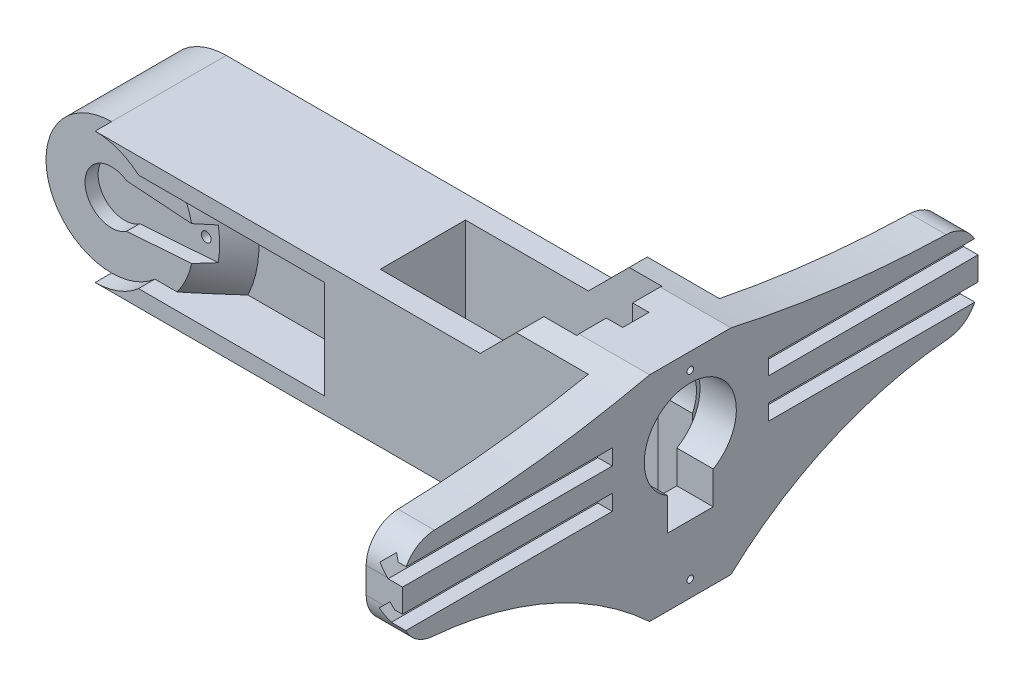
from build123d import *

# Parameters (mm, degrees)
SKETCH1_R                = 2
BOSS_EXTRUDE3_DEPTH      = 7
SKETCH3_R                = 1.0000000000000002
SKETCH3_R_2              = 0.9999999999999998
SKETCH3_R_3              = 0.9999999999999996
SKETCH3_R_4              = 0.9999999999999993
CUT_EXTRUDE2_DEPTH       = 26.09227496303999
BOSS_EXTRUDE4_START      = -7
BOSS_EXTRUDE4_DEPTH      = 7
BOSS_EXTRUDE5_START      = -30
BOSS_EXTRUDE5_DEPTH      = 30
FILLET2_R                = 1.5
CUT_EXTRUDE5_DEPTH       = 42.36510924463761
BOSS_EXTRUDE6_DEPTH      = 10.5
MOVE_START               = -28.7
MOVE_FACE1_DEPTH         = 5.7
DELETEFACE1_START        = 23.7
DELETEFACE1_OUTLINE_W    = 10.499999999999998
DELETEFACE1_OUTLINE_H    = 35.699999999999996
DELETEFACE1_DEPTH        = 15.7
SKETCH11_OUTSIDE_W       = 51.876
SKETCH11_OUTSIDE_H       = 42.462
CUT_EXTRUDE6_DEPTH       = 46.16926949380307
SERVO_START              = -12.760864102
SERVO_MICRO_OUTLINE_W    = 22.6
SERVO_MICRO_OUTLINE_H    = 12.399999999999999
SERVO_MICRO_DEPTH        = 22.3
SERVO_START_2            = 9.539135898
SERVO_MICRO_2_DEPTH      = 4.3
SERVO_START_3            = 2.889135898
SERVO_MICRO_3_DEPTH      = 2.4
SERVO_START_4            = 13.839135898
SERVO_MICRO_4_OUTLINE_R  = 2.5
SERVO_MICRO_4_DEPTH      = 3.3
SERVO_START_5            = -25.667487826
SERVO_MICRO_5_OUTLINE_R  = 0.6
SERVO_MICRO_5_DEPTH      = 2.3
SERVO_MICRO_6_OUTLINE_R  = 0.6
SERVO_MICRO_6_DEPTH      = 2.3
SERVO_MICRO_7_OUTLINE_R  = 0.6
SERVO_MICRO_7_DEPTH      = 2.3
BODY_MOVE_COPY1_ANGLE    = 90
SKETCH13_R               = 0.5000000000000009
SKETCH13_W               = 12.399999999999997
SKETCH13_H               = 4.17
SKETCH13_H_2             = 4.160545319150279
BOSS_EXTRUDE7_DEPTH      = 5.55
SKETCH13_3_W             = 12.399999999999997
SKETCH13_3_H             = 4.17
SKETCH13_3_R             = 0.5000000000000009
SKETCH13_3_H_2           = 4.160545319150279
BOSS_EXTRUDE8_DEPTH      = 10.8
CUT_EXTRUDE7_DEPTH       = 32
BOSS_EXTRUDE9_DEPTH      = 5.55
CUT_EXTRUDE8_DEPTH       = 72.0125468998838
BOSS_EXTRUDE10_DEPTH     = 5.55
FILLET4_R                = 5
CUT_EXTRUDE10_DEPTH      = 72.01254695034633
FILLET9_R                = 1
CUT_EXTRUDE12_DEPTH      = 69.37995941638475
CUT_EXTRUDE12_DEPTH_BACK = 69.37995941638475
BOSS_EXTRUDE11_DEPTH     = 70
BOSS_EXTRUDE12_REACH     = 82.196
SKETCH24_R               = 9.99999999999995
CHAMFER1_SIZE            = 7.5
SKETCH25_R               = 3.7999999999999967
CUT_EXTRUDE13_DEPTH      = 5
CUT_EXTRUDE14_DEPTH      = 30
BOSS_EXTRUDE13_DEPTH     = 9.999999999999996
BOSS_EXTRUDE14_DEPTH     = 25.25
SKETCH30_W               = 20
SKETCH30_H               = 14.999999999999993
BOSS_EXTRUDE15_DEPTH     = 5
CHAMFER2_START           = -5.424363199
CHAMFER2_DEPTH           = 4.330127019
CHAMFER3_START           = -5.429821862
CHAMFER3_DEPTH           = 4.330127019
CHAMFER4_START           = -22.981270045
CHAMFER4_DEPTH           = 4.330127019
CHAMFER5_START           = -22.975811382
CHAMFER5_DEPTH           = 4.330127018
CHAMFER6_SIZE            = 6.5
SKETCH31_R               = 0.5999999999998328
SKETCH31_R_2             = 0.8000000000000026
CUT_EXTRUDE15_DEPTH      = 4.5
CUT_EXTRUDE16_DEPTH      = 2.5
CUT_EXTRUDE17_DEPTH      = 12
CUT_EXTRUDE17_DEPTH_BACK = 4
SKETCH34_R               = 0.7499999999999986
CUT_EXTRUDE18_REACH      = 102.79
SKETCH36_R               = 6.5
CUT_EXTRUDE19_DEPTH      = 20
SKETCH37_W               = 3.444399263997859
SKETCH37_H               = 3.2882016681767823
CUT_EXTRUDE20_DEPTH      = 10
SKETCH39_W               = 2.5
SKETCH39_H               = 3.9999999999999964
CUT_EXTRUDE22_DEPTH      = 12


with BuildPart() as part:
    # Sketch1 → Boss-Extrude3 (new body)
    with BuildSketch(Plane.XY):
        with BuildLine():
            Line((5.606455718863049, 13.824363162033857), (-15.462379801128069, 15.791841653866829))
            Line((-15.462379801128069, 15.791841653866829), (-15.46237980112806, -15.791841653866806))
            Line((-15.46237980112806, -15.791841653866806), (5.606455718863063, -13.824363162033817))
            ThreePointArc((5.606455718863063, -13.824363162033817), (18.200000000000003, 2.613e-14), (5.606455718863049, 13.824363162033857))
        make_face()
        Circle(SKETCH1_R, mode=Mode.SUBTRACT)
    extrude(amount=BOSS_EXTRUDE3_DEPTH)

    # Sketch3 → Cut-Extrude2 (cut, through all)
    with BuildSketch(Plane.XY.offset(7)):
        with Locations((-4.5, 0)):
            Circle(SKETCH3_R)
        with Locations((-8.499999999999998, 0)):
            Circle(SKETCH3_R_2)
        with Locations(Location((4.5, -1.73e-15, 0), (0, 0, 180))):
            Circle(SKETCH3_R_3)
        with Locations(Location((8.499999999999998, -1.73e-15, 0), (0, 0, 180))):
            Circle(SKETCH3_R_4)
    extrude(amount=-CUT_EXTRUDE2_DEPTH, mode=Mode.SUBTRACT)

    # Sketch6 → Boss-Extrude4 (add)
    with BuildSketch(Plane.XY.offset(7).offset(BOSS_EXTRUDE4_START)):
        with BuildLine():
            Line((12.20372638619735, 13.208287910486863), (5.606455718863047, 13.824363162033858))
            ThreePointArc((5.606455718863047, 13.82436316203386), (18.2, 2.598e-14), (5.606455718863056, -13.824363162033816))
            Line((5.606455718863056, -13.824363162033816), (12.203726386197348, -13.208287910486817))
            ThreePointArc((12.203726386197348, -13.208287910486817), (19.699999999999996, 2.132e-14), (12.20372638619735, 13.20828791048686))
        make_face()
    extrude(amount=BOSS_EXTRUDE4_DEPTH)

    # Sketch6<3> → Boss-Extrude5 (add)
    with BuildSketch(Plane.XY.offset(7).offset(BOSS_EXTRUDE5_START)):
        with BuildLine():
            Line((23.700000000000006, 12.13472734042489), (12.20372638619735, 13.208287910486863))
            ThreePointArc((12.20372638619735, 13.20828791048686), (19.699999999999996, 2.132e-14), (12.203726386197348, -13.208287910486817))
            Line((12.203726386197348, -13.208287910486817), (23.700000000000003, -12.134727340424835))
            Line((23.700000000000003, -12.134727340424835), (23.700000000000006, 12.134727340424892))
        make_face()
    extrude(amount=BOSS_EXTRUDE5_DEPTH)

    # Fillet2
    fillet2_edges = [part.edges().sort_by_distance(p)[0] for p in [
        (12.20372638619735, -13.208287910486817, -11.5),
        (12.20372638619735, 13.208287910486861, -11.5),
    ]]
    fillet(fillet2_edges, radius=FILLET2_R)

    # Sketch8 → Cut-Extrude5 (cut, through all)
    with BuildSketch(Plane.XY.offset(7)):
        with BuildLine():
            Line((-15.462379801128069, 15.791841653866829), (-15.46237980112806, -15.791841653866808))
            Line((-15.46237980112806, -15.791841653866806), (1.328273056892355, -14.223874201150027))
            ThreePointArc((1.3282730568923518, -14.22387420115002), (-14.285758873920813, 0), (1.3282730568923529, 14.22387420115002))
            Line((1.3282730568923604, 14.223874201150062), (-15.462379801128069, 15.791841653866829))
        make_face()
    extrude(amount=-CUT_EXTRUDE5_DEPTH, mode=Mode.SUBTRACT)

    # Sketch10 → Boss-Extrude6 (add)
    with BuildSketch(Plane.ZX.offset(1.6347273404248903)):
        Polygon((7, 23.700000000000003), (7, 39.40000000018666), (-28.700000000000003, 39.40000000018665), (-28.700000000000014, 23.700000000000003), align=None)
    extrude(amount=BOSS_EXTRUDE6_DEPTH)

    # Move Face1: read off the stored shape, not the designer's step
    # Move Face1 outline → Move Face1 (add)
    with BuildSketch(Plane.XY.offset(MOVE_START)):
        with BuildLine():
            Line((17.033263706, -12.757289525), (23.7, -12.13472734))
            Line((23.7, -12.13472734), (23.7, 12.13472734))
            Line((23.7, 12.13472734), (17.033263706, 12.757289525))
            ThreePointArc((17.033263706, 12.757289525), (15.554272674, 11.938827155), (15.776353621, 10.263125757))
            ThreePointArc((15.776353621, 10.263125757), (19.7, 0), (15.776353621, -10.263125757))
            ThreePointArc((15.776353621, -10.263125757), (15.554272674, -11.938827155), (17.033263706, -12.757289525))
        make_face()
    extrude(amount=MOVE_FACE1_DEPTH)

    # DeleteFace1: read off the stored shape, not the designer's step
    # DeleteFace1 outline → DeleteFace1 (cut)
    with BuildSketch(Plane.YZ.offset(DELETEFACE1_START)):
        with Locations((6.884727339999999, -10.849999999999998)):
            Rectangle(DELETEFACE1_OUTLINE_W, DELETEFACE1_OUTLINE_H)
    extrude(amount=DELETEFACE1_DEPTH, mode=Mode.SUBTRACT)

    # Sketch11 outside → Cut-Extrude6 (cut, through all)
    with BuildSketch(Plane.XY.offset(7)):
        with Locations((4.706999999999997, 0)):
            Rectangle(SKETCH11_OUTSIDE_W, SKETCH11_OUTSIDE_H)
        with BuildLine():
            Line((23.700000000000003, 12.134727340424888), (-1.43e-15, 12.134727340424885))
            ThreePointArc((-1.43e-15, 12.134727340424885), (-12.134727340424885, 1.49e-15), (0, -12.134727340424885))
            Line((0, -12.134727340424885), (23.700000000000006, -12.134727340424835))
            Line((23.700000000000006, -12.134727340424835), (23.700000000000003, 12.134727340424888))
        make_face(mode=Mode.SUBTRACT)
    extrude(amount=-CUT_EXTRUDE6_DEPTH, mode=Mode.SUBTRACT)

    # Sketch13 → Boss-Extrude7 (add)
    # profile 1 of 3: a face of its own
    with BuildSketch(Plane(origin=(23.700000000000003, -3.39e-15, 0), x_dir=(0, 0, -1), z_dir=(1, -1.4e-16, 0))):
        Polygon((-9.000000000000002, -16.295272659575108), (-9.000000000000002, -12.134727340424831), (-7, -12.134727340424831), (-6.999999999999999, 12.134727340424892), (-9.000000000000002, 12.13472734042489), (-9.000000000000002, 16.30472734042489), (-21.4, 16.30472734042489), (-21.4, 12.13472734042489), (-59.100000000000016, 12.134727340424885), (-59.100000000000016, -12.134727340424831), (-21.4, -12.134727340424831), (-21.4, -16.295272659575108), align=None)
        with Locations(Location((-15.200000000000001, 13.80472734042489, 0), (0, 0, 90))):
            Circle(SKETCH13_R, mode=Mode.SUBTRACT)
        with Locations(Location((-15.200000000000001, -13.79527265957511, 0), (0, 0, 90))):
            Circle(SKETCH13_R, mode=Mode.SUBTRACT)
        with BuildLine():
            ThreePointArc((-11.700000000000001, -0.9920668991734916), (-15.199999999999998, 12.13472734042489), (-18.700000000000003, -0.9920668991734924))
            Line((-18.700000000000003, -0.9920668991734924), (-18.700000000000003, -5.9920668991734924))
            Line((-18.700000000000003, -5.9920668991734924), (-11.700000000000003, -5.992066899173492))
            Line((-11.700000000000003, -5.992066899173492), (-11.700000000000001, -0.9920668991734916))
        make_face(mode=Mode.SUBTRACT)
    # profile 2 of 3: a face of its own
    with BuildSketch(Plane(origin=(23.700000000000003, -3.39e-15, 0), x_dir=(0, 0, -1), z_dir=(1, -1.4e-16, 0))):
        with Locations((-15.2, 14.219727340424889)):
            Rectangle(SKETCH13_W, SKETCH13_H)
        with Locations(Location((-15.200000000000001, 13.80472734042489, 0), (0, 0, 90))):
            Circle(SKETCH13_R, mode=Mode.SUBTRACT)
    # profile 3 of 3: a face of its own
    with BuildSketch(Plane(origin=(23.700000000000003, -3.39e-15, 0), x_dir=(0, 0, -1), z_dir=(1, -1.4e-16, 0))):
        with Locations((-15.2, -14.214999999999968)):
            Rectangle(SKETCH13_W, SKETCH13_H_2)
        with Locations(Location((-15.200000000000001, -13.79527265957511, 0), (0, 0, 90))):
            Circle(SKETCH13_R, mode=Mode.SUBTRACT)
    extrude(amount=-BOSS_EXTRUDE7_DEPTH)

    # Sketch13<3> → Boss-Extrude8 (add)
    # profile 1 of 2: a face of its own
    with BuildSketch(Plane(origin=(23.700000000000003, -3.39e-15, 0), x_dir=(0, 0, -1), z_dir=(1, -1.4e-16, 0))):
        with Locations((-15.2, 14.219727340424889)):
            Rectangle(SKETCH13_3_W, SKETCH13_3_H)
        with Locations(Location((-15.200000000000001, 13.80472734042489, 0), (0, 0, 90))):
            Circle(SKETCH13_3_R, mode=Mode.SUBTRACT)
    # profile 2 of 2: a face of its own
    with BuildSketch(Plane(origin=(23.700000000000003, -3.39e-15, 0), x_dir=(0, 0, -1), z_dir=(1, -1.4e-16, 0))):
        with Locations((-15.2, -14.214999999999968)):
            Rectangle(SKETCH13_3_W, SKETCH13_3_H_2)
        with Locations(Location((-15.200000000000001, -13.79527265957511, 0), (0, 0, 90))):
            Circle(SKETCH13_3_R, mode=Mode.SUBTRACT)
    extrude(amount=-BOSS_EXTRUDE8_DEPTH)

    # Sketch15 → Cut-Extrude7 (cut)
    with BuildSketch(Plane(origin=(1.903e-14, 0, -28.70000000000003), x_dir=(-1, 0, -6.6e-16), z_dir=(6.6e-16, 0, -1))):
        Polygon((-22.49411254969542, 9.504727340424887), (-23.699999999999985, 9.504727340424887), (-23.699999999999985, 7.104727340424887), (-21.499999999999986, 7.104727340424887), (-20.08578643762689, 8.518940902797986), (-21.782842712474608, 10.215997177645699), align=None)
        Polygon((-22.49411254969542, 3.504727340424887), (-23.699999999999985, 3.504727340424887), (-23.699999999999985, 1.104727340424887), (-21.499999999999986, 1.104727340424887), (-20.08578643762689, 2.5189409027979863), (-21.782842712474608, 4.2159971776457), align=None)
    cut_extrude7 = extrude(amount=-CUT_EXTRUDE7_DEPTH, mode=Mode.SUBTRACT)

    # Mirror1: Cut-Extrude7 across plane
    add(cut_extrude7.mirror(Plane(origin=(0, 0, 15.200000000000001), x_dir=(1, 0, 0), z_dir=(0, 0, -1))), mode=Mode.SUBTRACT)

    # Sketch16 → Boss-Extrude9 (add)
    with BuildSketch(Plane(origin=(23.700000000000003, -3.39e-15, 0), x_dir=(0, 0, -1), z_dir=(1, -1.4e-16, 0))):
        with BuildLine():
            Line((-21.4, 12.13472734042489), (-21.4, 16.30472734042489))
            ThreePointArc((-21.4, 16.30472734042489), (-40.135039546574305, 13.18039662240372), (-59.100000000000016, 12.134727340424885))
            Line((-59.100000000000016, 12.134727340424885), (-21.4, 12.13472734042489))
        make_face()
        with BuildLine():
            Line((-9.000000000000002, 16.30472734042489), (-9.000000000000002, 12.13472734042489))
            Line((-9.000000000000002, 12.13472734042489), (28.700000000000014, 12.134727340424892))
            ThreePointArc((28.700000000000014, 12.134727340424892), (9.735039546574328, 13.180396622403777), (-9.000000000000002, 16.30472734042489))
        make_face()
    extrude(amount=-BOSS_EXTRUDE9_DEPTH)

    # Sketch18 → Cut-Extrude8 (cut, through all)
    with BuildSketch(Plane(origin=(23.700000000000003, -3.39e-15, 0), x_dir=(0, 0, -1), z_dir=(1, -1.4e-16, 0))):
        with BuildLine():
            Line((-59.100000000000016, -12.134727340424831), (-26.464597831204948, -12.134727340424831))
            ThreePointArc((-26.464597831204948, -12.134727340424838), (-41.94169294959438, -4.244239035708318), (-59.100000000000016, -1.5252726595751156))
            Line((-59.100000000000016, -1.5252726595751027), (-59.100000000000016, -12.134727340424831))
        make_face()
        with BuildLine():
            Line((-3.9354021687950578, -12.134727340424831), (28.700000000000003, -12.134727340424831))
            Line((28.700000000000003, -12.134727340424831), (28.700000000000003, -1.5252726595751027))
            ThreePointArc((28.700000000000003, -1.5252726595751014), (11.541692949594374, -4.244239035708304), (-3.9354021687950613, -12.134727340424817))
        make_face()
    extrude(amount=-CUT_EXTRUDE8_DEPTH, mode=Mode.SUBTRACT)

    # Sketch18<3> → Boss-Extrude10 (add)
    with BuildSketch(Plane(origin=(23.700000000000003, -3.39e-15, 0), x_dir=(0, 0, -1), z_dir=(1, -1.4e-16, 0))):
        with BuildLine():
            ThreePointArc((-26.464597831204948, -12.134727340424838), (-23.87082552911989, -14.140168948785742), (-21.4, -16.29527265957512))
            Line((-21.4, -16.295272659575108), (-21.4, -12.134727340424831))
            Line((-21.4, -12.134727340424831), (-26.464597831204944, -12.134727340424831))
        make_face()
        with BuildLine():
            ThreePointArc((-9.000000000000004, -16.295272659575105), (-6.529174470880125, -14.140168948785721), (-3.9354021687950613, -12.134727340424817))
            Line((-3.9354021687950587, -12.134727340424831), (-9.000000000000005, -12.134727340424831))
            Line((-9.000000000000005, -12.134727340424831), (-9.000000000000005, -16.295272659575108))
        make_face()
    extrude(amount=-BOSS_EXTRUDE10_DEPTH)

    # Fillet4
    fillet4_edges = [part.edges().sort_by_distance(p)[0] for p in [
        (21.662101458938174, -1.5252726595751052, -28.700000000000003),
        (20.925, -1.525272659575112, 59.100000000000016),
        (20.925000000000004, 12.134727340424881, 59.100000000000016),
    ]]
    fillet(fillet4_edges, radius=FILLET4_R)

    # Sketch19 → Cut-Extrude10 (cut, through all)
    with BuildSketch(Plane(origin=(23.700000000000003, -3.39e-15, 0), x_dir=(0, 0, -1), z_dir=(1, -1.4e-16, 0))):
        with BuildLine():
            Line((24.105591483628846, 12.321380196120076), (30.19974331893468, 12.321380196120076))
            Line((30.19974331893468, 12.321380196120076), (30.19974331893468, 7.512752922909521))
            Line((30.19974331893468, 7.512752922909521), (28.687547870024137, 7.690513778051795))
            ThreePointArc((28.687547870024137, 7.690513778051795), (28.58393863914358, 8.408905582685197), (28.37741082226619, 9.10472734042489))
            ThreePointArc((28.37741082226619, 9.10472734042489), (26.70764725474025, 11.33211091295099), (24.105591483628846, 12.321380196120076))
        make_face()
    extrude(amount=-CUT_EXTRUDE10_DEPTH, mode=Mode.SUBTRACT)

    # Fillet9
    fillet9_edges = [part.edges().sort_by_distance(p)[0] for p in [
        (18.150000000000002, 2.76e-14, 7),
    ]]
    fillet(fillet9_edges, radius=FILLET9_R)

    # Sketch22 → Cut-Extrude12 (cut, two sides: drawn at the far end of the back side and taken through both)
    with BuildSketch(Plane.ZY.offset(-18.15).offset(-CUT_EXTRUDE12_DEPTH_BACK)):
        Polygon((15.200000000000001, 13.80472734042489), (15.200000000000001, -21.5200756959896), (-43.4695777829905, 0), (-33.75098645134665, 32.930662038836886), (15.200000000000001, 22.945807930983616), align=None)
    extrude(amount=CUT_EXTRUDE12_DEPTH + CUT_EXTRUDE12_DEPTH_BACK, mode=Mode.SUBTRACT)

    # Mirror2: part across plane


with BuildPart() as body_2:
    # Servo Micro: read off the stored shape, not the designer's step
    # Servo Micro outline → Servo Micro (new body)
    with BuildSketch(Plane(origin=(0, 0, 0), x_dir=(1, 0, 0), z_dir=(0, 1, 0)).offset(SERVO_START)):
        with Locations((-12.067487826, -26.388081974)):
            Rectangle(SERVO_MICRO_OUTLINE_W, SERVO_MICRO_OUTLINE_H)
    extrude(amount=SERVO_MICRO_DEPTH)

    # Servo Micro 2 outline → Servo Micro 2 (add)
    with BuildSketch(Plane(origin=(0, 0, 0), x_dir=(1, 0, 0), z_dir=(0, 1, 0)).offset(SERVO_START_2)):
        with BuildLine():
            ThreePointArc((-11.10082116, -25.109193568), (-23.367487826, -26.388081974), (-11.10082116, -27.666970381))
            ThreePointArc((-11.10082116, -27.666970381), (-9.567487826, -26.388081975), (-11.10082116, -25.109193568))
        make_face()
    extrude(amount=SERVO_MICRO_2_DEPTH)

    # Servo Micro 3 outline → Servo Micro 3 (add)
    with BuildSketch(Plane(origin=(0, 0, 0), x_dir=(1, 0, 0), z_dir=(0, 1, 0)).offset(SERVO_START_3)):
        with BuildLine():
            Line((2.567676828, -25.838081974), (4.232512174, -25.838081974))
            Line((4.232512174, -25.838081974), (4.232512174, -20.188081974))
            Line((4.232512174, -20.188081974), (-0.767487826, -20.188081974))
            Line((-0.767487826, -20.188081974), (-0.767487826, -32.588081974))
            Line((-0.767487826, -32.588081974), (4.232512174, -32.588081974))
            Line((4.232512174, -32.588081974), (4.232512174, -26.938081974))
            Line((4.232512174, -26.938081974), (2.567676828, -26.938081974))
            ThreePointArc((2.567676828, -26.938081974), (0.732512174, -26.388081974), (2.567676828, -25.838081974))
        make_face()
        with BuildLine():
            Line((-23.367487826, -32.588081974), (-23.367487826, -20.188081974))
            Line((-23.367487826, -20.188081974), (-28.367487826, -20.188081974))
            Line((-28.367487826, -20.188081974), (-28.367487826, -25.838081974))
            Line((-28.367487826, -25.838081974), (-26.702652481, -25.838081974))
            ThreePointArc((-26.702652481, -25.838081974), (-24.867487826, -26.388081974), (-26.702652481, -26.938081974))
            Line((-26.702652481, -26.938081974), (-28.367487826, -26.938081974))
            Line((-28.367487826, -26.938081974), (-28.367487826, -32.588081974))
            Line((-28.367487826, -32.588081974), (-23.367487826, -32.588081974))
        make_face()
    extrude(amount=SERVO_MICRO_3_DEPTH)

    # Servo Micro 4 outline → Servo Micro 4 (add)
    with BuildSketch(Plane(origin=(0, 0, 0), x_dir=(1, 0, 0), z_dir=(0, 1, 0)).offset(SERVO_START_4)):
        with Locations((-17.167487826, -26.388081974)):
            Circle(SERVO_MICRO_4_OUTLINE_R)
    extrude(amount=SERVO_MICRO_4_DEPTH)


with BuildPart() as body_3:
    # Servo Micro 5 outline → Servo Micro 5 (new body)
    with BuildSketch(Plane.YZ.offset(SERVO_START_5)):
        with Locations((-8.260864102, 25.188081974)):
            Circle(SERVO_MICRO_5_OUTLINE_R)
    extrude(amount=SERVO_MICRO_5_DEPTH)


with BuildPart() as body_4:
    # Servo Micro 6 outline → Servo Micro 6 (new body)
    with BuildSketch(Plane.YZ.offset(SERVO_START_5)):
        with Locations((-8.260864102, 27.588081974)):
            Circle(SERVO_MICRO_6_OUTLINE_R)
    extrude(amount=SERVO_MICRO_6_DEPTH)


with BuildPart() as body_5:
    # Servo Micro 7 outline → Servo Micro 7 (new body)
    with BuildSketch(Plane.YZ.offset(SERVO_START_5)):
        with Locations((-8.260864102, 26.388081974)):
            Circle(SERVO_MICRO_7_OUTLINE_R)
    extrude(amount=SERVO_MICRO_7_DEPTH)


with BuildPart() as body_2_1:
    # Body-Move/Copy1: read off the stored shape, not the designer's step
    # Body-Move/Copy1: moved
    add(body_2.part.moved(Location((12.0627605, 7.6108641, -11.188082))).rotate(Axis((0, 0, 0), (0, 0, -1)), BODY_MOVE_COPY1_ANGLE))


with BuildPart() as part_1:
    add(part.part)
    add(part.part.mirror(Plane(origin=(23.700000000000014, 13.80472734042489, 15.200000000000001), x_dir=(1, 0, 0), z_dir=(0, 0, 1))))



with BuildPart() as body_2_2:
    # Sketch23 → Boss-Extrude11 (new body)
    with BuildSketch(Plane.ZY.offset(-12.9)):
        Polygon((5.200000000000005, -9.995272659575157), (25.200000000000006, -9.995272659575157), (25.200000000000006, -7.495272659575142), (17.700000000000006, -7.495272659575142), (17.700000000000006, 7.504727340424927), (25.200000000000006, 7.504727340424844), (25.200000000000006, 10.004727340424843), (5.200000000000005, 10.004727340424857), (5.200000000000003, 7.504727340424844), (12.700000000000001, 7.504727340424927), (12.700000000000001, -7.495272659575142), (5.200000000000003, -7.495272659575142), align=None)
    extrude(amount=BOSS_EXTRUDE11_DEPTH)

    # Boss-Extrude12: up to this face of the body (flat: up to its plane)
    boss_extrude12_end = Plane(body_2_2.part.faces().sort_by_distance((-22.1, 8.75472734, 5.2))[0])
    # Sketch24 → Boss-Extrude12 (add, up to the picked face)
    with BuildSketch(Plane.XY.offset(25.200000000000006), mode=Mode.PRIVATE) as boss_extrude12_sk1:
        with Locations((-57.10000000000001, 0.00472734042490132)):
            Circle(SKETCH24_R)
    boss_extrude12_tool1 = split(extrude(boss_extrude12_sk1.sketch, amount=-BOSS_EXTRUDE12_REACH, mode=Mode.PRIVATE), bisect_by=boss_extrude12_end, keep=Keep.BOTH, mode=Mode.PRIVATE)
    add(boss_extrude12_tool1.solids().sort_by(Axis((-57.1, 0.004727, 25.2), (0, 0, -1)))[0])

    # Chamfer1
    chamfer1_edges = [body_2_2.edges().sort_by_distance(p)[0] for p in [
        (-47.10000000000006, 0.00472734042485425, 12.700000000000001),
        (-47.10000000000006, 0.00472734042485425, 17.700000000000006),
    ]]
    chamfer(chamfer1_edges, length=CHAMFER1_SIZE - 0.0001)  # a hair under: the kernel refuses the full size

    # Sketch25 → Cut-Extrude13 (cut)
    with BuildSketch(Plane(origin=(0, -3.61e-15, 5.199999999999998), x_dir=(-1, 0, 0), z_dir=(0, 6.9e-16, -1))):
        with Locations(Location((57.10000000000001, 0.00472734042490493, 0), (0, 0, 90))):
            Circle(SKETCH25_R)
    extrude(amount=-CUT_EXTRUDE13_DEPTH, mode=Mode.SUBTRACT)

    # Sketch26 → Cut-Extrude14 (cut)
    with BuildSketch(Plane.ZY.offset(-12.9)):
        Polygon((9.30000000000001, 11.20472734042489), (21.1, 11.20472734042489), (21.10000000000001, -11.195272659575108), (9.300000000000006, -11.195272659575108), align=None)
    extrude(amount=CUT_EXTRUDE14_DEPTH, mode=Mode.SUBTRACT)


with BuildPart() as part_2:
    add(part_1.part)

    add(body_2_2.part)  # Boss-Extrude13 merges body 2 2
    # Sketch28 → Boss-Extrude13 (add)
    with BuildSketch(Plane.ZY.offset(-18.15)):
        with BuildLine():
            Line((9.300000000000006, -9.995272659575157), (9.300000000000006, 16.30472734042489))
            Line((9.300000000000006, 16.30472734042489), (9.000000000000002, 16.304727340424876))
            ThreePointArc((9.000000000000002, 16.304727340424876), (7.102269488512391, 15.890916990007383), (5.200000000000003, 15.498500255631015))
            Line((5.200000000000003, 15.498500255631015), (5.200000000000005, 10.004727340424857))
            Line((5.200000000000005, 10.004727340424857), (5.200000000000003, -13.081913708854549))
            ThreePointArc((5.200000000000003, -13.081913708854549), (7.13603520112882, -14.64597928194324), (9.000000000000002, -16.2952726595751))
            Line((9.000000000000002, -16.2952726595751), (9.300000000000006, -16.295272659575108))
            Line((9.300000000000006, -16.295272659575108), (9.300000000000006, -9.995272659575157))
        make_face()
        with BuildLine():
            Line((25.2, 10.004727340424857), (25.2, -13.081913708854549))
            ThreePointArc((25.2, -13.081913708854549), (23.263964798871186, -14.645979281943227), (21.4, -16.295272659575105))
            Line((21.4, -16.295272659575105), (21.099999999999998, -16.295272659575108))
            Line((21.099999999999998, -16.295272659575108), (21.099999999999998, -9.995272659575157))
            Line((21.099999999999998, -9.995272659575157), (21.099999999999998, 16.30472734042489))
            Line((21.099999999999998, 16.30472734042489), (21.4, 16.30472734042489))
            ThreePointArc((21.4, 16.30472734042489), (23.29773051148763, 15.890916990007383), (25.2, 15.498500255631015))
            Line((25.2, 15.498500255631015), (25.2, 10.004727340424857))
        make_face()
    extrude(amount=BOSS_EXTRUDE13_DEPTH)

    # Sketch29 → Boss-Extrude14 (add)
    with BuildSketch(Plane.ZY.offset(-8.150000000000004)):
        Polygon((9.300000000000006, -7.495272659575142), (9.300000000000006, 7.504727340424879), (5.2000000000000055, 7.504727340424845), (5.20000000000001, -7.495272659575141), align=None)
        Polygon((21.1, 7.504727340424889), (21.10000000000001, -7.495272659575142), (25.200000000000006, -7.495272659575142), (25.200000000000006, 7.504727340424844), align=None)
    extrude(amount=BOSS_EXTRUDE14_DEPTH)

    # Sketch30 → Boss-Extrude15 (add)
    with BuildSketch(Plane.ZY.offset(17.099999999999998)):
        with Locations((15.200000000000006, 0.0047273404248549)):
            Rectangle(SKETCH30_W, SKETCH30_H)
    extrude(amount=BOSS_EXTRUDE15_DEPTH)

    # Chamfer2: read off the stored shape, not the designer's step
    # Chamfer2 outline → Chamfer2 (add)
    with BuildSketch(Plane(origin=(0, 0, 0), x_dir=(0.8164965809277258, -0.40824829046386313, -0.40824829046386313), z_dir=(0.5773502691896258, 0.5773502691896258, 0.5773502691896258)).offset(CHAMFER2_START)):
        Polygon((-32.416844191, -3.673612528), (-23.231257656, -8.976913387), (-23.231257656, 1.629688331), align=None)
    extrude(amount=CHAMFER2_DEPTH)

    # Chamfer3: read off the stored shape, not the designer's step
    # Chamfer3 outline → Chamfer3 (add)
    with BuildSketch(Plane(origin=(0, 0, 0), x_dir=(0.8164965809277258, 0.40824829046386313, -0.40824829046386313), z_dir=(0.5773502691896258, -0.5773502691896258, 0.5773502691896258)).offset(CHAMFER3_START)):
        Polygon((-32.412984334, 3.680297997), (-23.227397799, -1.623002862), (-23.227397799, 8.983598856), align=None)
    extrude(amount=CHAMFER3_DEPTH)

    # Chamfer4: read off the stored shape, not the designer's step
    # Chamfer4 outline → Chamfer4 (add)
    with BuildSketch(Plane(origin=(0, 0, 0), x_dir=(0.8164965809277258, 0.40824829046386313, 0.40824829046386313), z_dir=(0.5773502691896258, -0.5773502691896258, -0.5773502691896258)).offset(CHAMFER4_START)):
        Polygon((-20.002236304, 17.815748151), (-10.816649769, 12.512447293), (-10.816649769, 23.11904901), align=None)
    extrude(amount=CHAMFER4_DEPTH)

    # Chamfer5: read off the stored shape, not the designer's step
    # Chamfer5 outline → Chamfer5 (add)
    with BuildSketch(Plane(origin=(0, 0, 0), x_dir=(0.8164965809277258, -0.40824829046386313, 0.40824829046386313), z_dir=(0.5773502691896258, 0.5773502691896258, -0.5773502691896258)).offset(CHAMFER5_START)):
        Polygon((-20.006096161, -17.82243362), (-10.820509626, -23.125734479), (-10.820509626, -12.519132761), align=None)
    extrude(amount=CHAMFER5_DEPTH)

    # Chamfer6
    # the kernel refuses this chamfer: 6.5 mm, written as the material it adds along each edge
    with BuildSketch(Plane(origin=(8.15, -9.995272659575159, 25.200000000000003), x_dir=(0, -1, 0), z_dir=(0, 0, -1))) as chamfer6_piece_1_section:
        Polygon((CHAMFER6_SIZE, 0), (-1.78e-15, CHAMFER6_SIZE), (0, 0), align=None)
    chamfer6_piece_1 = extrude(amount=4.100000000000005, mode=Mode.PRIVATE)
    chamfer6_piece_1 = chamfer6_piece_1 - Plane(origin=(8.149999999999993, -57.02435525942598, 59.09999999998831), x_dir=(0, 0.7917687913402176, -0.6108209075168032), z_dir=(1, -1.4e-16, 0)) * Cylinder(55.49908259984659, 35, mode=Mode.PRIVATE)
    chamfer6_piece_1 = split(chamfer6_piece_1, bisect_by=Plane(origin=(8.149999999999999, -16.295272659575065, 25.200000000000077), z_dir=(1.4e-16, 1, -1.184e-14)), keep=Keep.TOP, mode=Mode.PRIVATE)
    add(chamfer6_piece_1)
    with BuildSketch(Plane(origin=(8.15, -9.995272659575159, 25.200000000000003), x_dir=(0, -1, 0), z_dir=(0, 0, -1))) as chamfer6_piece_2_section:
        Polygon((CHAMFER6_SIZE, 0), (-1.78e-15, CHAMFER6_SIZE), (0, 0), align=None)
    chamfer6_piece_2 = extrude(amount=20.815939421778424, mode=Mode.PRIVATE)
    chamfer6_piece_2 = split(chamfer6_piece_2, bisect_by=Plane(origin=(8.149999999999999, -16.295272659575062, 25.200000000000077), z_dir=(1.4e-16, 1, -1.184e-14)), keep=Keep.TOP, mode=Mode.PRIVATE)
    chamfer6_piece_2 = split(chamfer6_piece_2, bisect_by=Plane(origin=(8.15, -9.995272659575145, 5.199999999999989), z_dir=(0, -7.1e-16, 1)), keep=Keep.TOP, mode=Mode.PRIVATE)
    chamfer6_piece_2 = split(chamfer6_piece_2, bisect_by=Plane(origin=(8.15, -9.995272659575157, 9.300000000000006), z_dir=(0, 1.6e-16, -1)), keep=Keep.TOP, mode=Mode.PRIVATE)
    chamfer6_piece_2 = chamfer6_piece_2 - Plane(origin=(8.149999999999993, -57.02435525943764, -28.69999999999815), x_dir=(0, 0.7917687913402102, 0.6108209075168127), z_dir=(1, -1.4e-16, 0)) * Cylinder(55.49908259986183, 68, mode=Mode.PRIVATE)
    add(chamfer6_piece_2)
    with BuildSketch(Plane(origin=(8.15, -9.995272659575157, 5.200000000000005), x_dir=(-1, 0, 0), z_dir=(0, 0, 1))) as chamfer6_piece_3_section:
        Polygon((CHAMFER6_SIZE, 0), (0, CHAMFER6_SIZE), (0, 0), align=None)
    chamfer6_piece_3 = extrude(amount=4.100000000000001, mode=Mode.PRIVATE)
    chamfer6_piece_3 = split(chamfer6_piece_3, bisect_by=Plane(origin=(8.149999999999999, -16.2952726595753, 5.200000000000079), z_dir=(1.4e-16, 1, -1.184e-14)), keep=Keep.TOP, mode=Mode.PRIVATE)
    chamfer6_piece_3 = chamfer6_piece_3 - Plane(origin=(8.149999999999993, -57.02435525943764, -28.69999999999815), x_dir=(0, 0.7917687913402102, 0.6108209075168127), z_dir=(1, -1.4e-16, 0)) * Cylinder(55.49908259986183, 35, mode=Mode.PRIVATE)
    add(chamfer6_piece_3)
    with BuildSketch(Plane(origin=(8.15, -9.995272659575157, 5.200000000000005), x_dir=(-1, 0, 0), z_dir=(0, 0, 1))) as chamfer6_piece_4_section:
        Polygon((CHAMFER6_SIZE, 0), (0, CHAMFER6_SIZE), (0, 0), align=None)
    chamfer6_piece_4 = extrude(amount=20.815939421778417, mode=Mode.PRIVATE)
    chamfer6_piece_4 = split(chamfer6_piece_4, bisect_by=Plane(origin=(8.15, -9.995272659575157, 25.200000000000003), z_dir=(0, 0, -1)), keep=Keep.TOP, mode=Mode.PRIVATE)
    chamfer6_piece_4 = chamfer6_piece_4 - Plane(origin=(8.149999999999993, -57.02435525942598, 59.09999999998831), x_dir=(0, 0.7917687913402176, -0.6108209075168032), z_dir=(1, -1.4e-16, 0)) * Cylinder(55.49908259984659, 68, mode=Mode.PRIVATE)
    chamfer6_piece_4 = split(chamfer6_piece_4, bisect_by=Plane(origin=(8.15, -9.995272659575152, 21.10000000000001), z_dir=(0, 3.2e-16, 1)), keep=Keep.TOP, mode=Mode.PRIVATE)
    chamfer6_piece_4 = split(chamfer6_piece_4, bisect_by=Plane(origin=(8.149999999999999, -16.295272659575303, 5.200000000000079), z_dir=(1.4e-16, 1, -1.184e-14)), keep=Keep.TOP, mode=Mode.PRIVATE)
    add(chamfer6_piece_4)
    with BuildSketch(Plane(origin=(8.150000000000004, 10.004727340424857, 4.384060578221579), x_dir=(-1, 2.7e-16, 0), z_dir=(0, -7.1e-16, 1))) as chamfer6_piece_5_section:
        Polygon((CHAMFER6_SIZE, 0), (1.78e-15, -CHAMFER6_SIZE), (0, 0), align=None)
    chamfer6_piece_5 = extrude(amount=20.815939421778424, mode=Mode.PRIVATE)
    chamfer6_piece_5 = split(chamfer6_piece_5, bisect_by=Plane(origin=(8.150000000000004, 10.004727340424857, 9.30000000000001), z_dir=(0, 1.6e-16, -1)), keep=Keep.TOP, mode=Mode.PRIVATE)
    chamfer6_piece_5 = split(chamfer6_piece_5, bisect_by=Plane(origin=(8.150000000000004, 10.004727340424857, 5.200000000000005), z_dir=(0, -7.1e-16, 1)), keep=Keep.TOP, mode=Mode.PRIVATE)
    chamfer6_piece_5 = split(chamfer6_piece_5, bisect_by=Plane(origin=(8.150000000000006, 16.304727340424886, 4.384060578221579), z_dir=(-1.4e-16, -1, 0)), keep=Keep.TOP, mode=Mode.PRIVATE)
    chamfer6_piece_5 = chamfer6_piece_5 - Plane(origin=(8.150000000000029, 184.63819256829515, -28.700000000011105), x_dir=(0, -0.975826572559034, 0.21854633441832977), z_dir=(1, -1.4e-16, 0)) * Cylinder(172.50346522787143, 68, mode=Mode.PRIVATE)
    add(chamfer6_piece_5)
    with BuildSketch(Plane(origin=(8.150000000000004, 10.004727340424845, 21.099999999999998), x_dir=(-1, 2.7e-16, 0), z_dir=(0, -7.1e-16, 1))) as chamfer6_piece_6_section:
        Polygon((CHAMFER6_SIZE, 0), (1.78e-15, -CHAMFER6_SIZE), (0, 0), align=None)
    chamfer6_piece_6 = extrude(amount=4.100000000000005, mode=Mode.PRIVATE)
    chamfer6_piece_6 = split(chamfer6_piece_6, bisect_by=Plane(origin=(8.150000000000006, 16.304727340424886, 21.099999999999998), z_dir=(-1.4e-16, -1, 0)), keep=Keep.TOP, mode=Mode.PRIVATE)
    chamfer6_piece_6 = chamfer6_piece_6 - Plane(origin=(8.150000000000029, 184.63819256775145, 59.099999999896355), x_dir=(0, -0.9758265725590253, -0.21854633441836852), z_dir=(1, -1.4e-16, 0)) * Cylinder(172.5034652273158, 35, mode=Mode.PRIVATE)
    add(chamfer6_piece_6)
    with BuildSketch(Plane(origin=(8.150000000000004, 10.004727340424841, 26.01593942177843), x_dir=(-1, 0, 0), z_dir=(0, 7.1e-16, -1))) as chamfer6_piece_7_section:
        Polygon((CHAMFER6_SIZE, 0), (0, CHAMFER6_SIZE), (0, 0), align=None)
    chamfer6_piece_7 = extrude(amount=20.815939421778424, mode=Mode.PRIVATE)
    chamfer6_piece_7 = split(chamfer6_piece_7, bisect_by=Plane(origin=(8.150000000000004, 10.004727340424841, 25.200000000000006), z_dir=(0, 0, -1)), keep=Keep.TOP, mode=Mode.PRIVATE)
    chamfer6_piece_7 = split(chamfer6_piece_7, bisect_by=Plane(origin=(8.150000000000004, 10.00472734042484, 21.1), z_dir=(0, 3.2e-16, 1)), keep=Keep.TOP, mode=Mode.PRIVATE)
    chamfer6_piece_7 = split(chamfer6_piece_7, bisect_by=Plane(origin=(8.150000000000006, 16.304727340424886, 26.01593942177843), z_dir=(-1.4e-16, -1, 0)), keep=Keep.TOP, mode=Mode.PRIVATE)
    chamfer6_piece_7 = chamfer6_piece_7 - Plane(origin=(8.150000000000029, 184.63819256775145, 59.099999999896355), x_dir=(0, -0.9758265725590253, -0.21854633441836852), z_dir=(1, -1.4e-16, 0)) * Cylinder(172.5034652273158, 68, mode=Mode.PRIVATE)
    add(chamfer6_piece_7)
    with BuildSketch(Plane(origin=(8.150000000000004, 10.004727340424854, 9.300000000000008), x_dir=(-1, 0, 0), z_dir=(0, 7.1e-16, -1))) as chamfer6_piece_8_section:
        Polygon((CHAMFER6_SIZE, 0), (0, CHAMFER6_SIZE), (0, 0), align=None)
    chamfer6_piece_8 = extrude(amount=4.100000000000001, mode=Mode.PRIVATE)
    chamfer6_piece_8 = split(chamfer6_piece_8, bisect_by=Plane(origin=(8.150000000000006, 16.304727340424886, 9.300000000000008), z_dir=(-1.4e-16, -1, 0)), keep=Keep.TOP, mode=Mode.PRIVATE)
    chamfer6_piece_8 = chamfer6_piece_8 - Plane(origin=(8.150000000000029, 184.63819256829515, -28.700000000011105), x_dir=(0, -0.975826572559034, 0.21854633441832977), z_dir=(1, -1.4e-16, 0)) * Cylinder(172.50346522787143, 35, mode=Mode.PRIVATE)
    add(chamfer6_piece_8)

    # Sketch31 → Cut-Extrude15 (cut)
    # profile 1 of 2: a face of its own
    with BuildSketch(Plane.XY.offset(25.200000000000006)):
        with BuildLine():
            Line((-58.966865821000376, -18.10509617026927), (-47.14523754516783, -17.45913430585771))
            ThreePointArc((-47.14523754516783, -17.45913430585771), (-44.87618390561842, -15.062709249511556), (-47.145237545167376, -12.666284193164977))
            Line((-47.145237545167376, -12.666284193164977), (-58.96686582099993, -12.020322328753586))
            ThreePointArc((-58.96686582099993, -12.020322328753586), (-60.079325783159106, -11.420203954737048), (-61.326183905618464, -11.212709249511649))
            ThreePointArc((-61.326183905618464, -11.212709249511649), (-65.17618390561822, -15.062709249511455), (-61.32618390561841, -18.912709249511973))
            ThreePointArc((-61.32618390561841, -18.912709249511973), (-60.07932578315924, -18.70521454428613), (-58.966865821000376, -18.10509617026927))
        make_face()
        with Locations((-48.87618390561842, -15.062709249511428)):
            Circle(SKETCH31_R, mode=Mode.SUBTRACT)
    # profile 2 of 2: a face of its own
    with BuildSketch(Plane.XY.offset(25.200000000000006)):
        with BuildLine():
            Line((-54.809388727871976, 3.344727340424902), (-42.87319721615001, 2.498467658826738))
            ThreePointArc((-42.87319721615001, 2.498467658826738), (-40.55000000000001, 0.00472734042490132), (-42.87319721615001, -2.4890129779769348))
            Line((-42.87319721615001, -2.4890129779769348), (-54.809388727871976, -3.335272659575099))
            ThreePointArc((-54.809388727871976, -3.335272659575099), (-61.150000000000006, 0.00472734042490182), (-54.809388727871976, 3.344727340424902))
        make_face()
        with Locations(Location((-44.650000000000006, 0.00472734042490132, 0), (0, 0, 245.94854836))):
            Circle(SKETCH31_R_2, mode=Mode.SUBTRACT)
    extrude(amount=-CUT_EXTRUDE15_DEPTH, mode=Mode.SUBTRACT)

    # Sketch33 → Cut-Extrude16 (cut)
    with BuildSketch(Plane.XY.offset(25.200000000000006)):
        with BuildLine():
            Line((-50.48562172233856, 7.504727340424852), (-41.288611699158096, 7.5047273404249335))
            Line((-41.288611699158096, 7.5047273404249335), (-41.288611699158096, -7.495272659575136))
            Line((-41.288611699158096, -7.495272659575136), (-50.48562172233865, -7.495272659575134))
            ThreePointArc((-50.48562172233865, -7.495272659575134), (-67.09999999999995, 0.00472734042496472), (-50.48562172233856, 7.504727340424852))
        make_face()
    extrude(amount=-CUT_EXTRUDE16_DEPTH, mode=Mode.SUBTRACT)

    # Sketch34 → Cut-Extrude17 (cut, two sides: drawn at the far end of the back side and taken through both)
    with BuildSketch(Plane.XY.offset(20.700000000000006).offset(-CUT_EXTRUDE17_DEPTH_BACK)):
        with Locations(Location((-44.650000000000006, 0.00472734042490132, 0), (0, 0, 87.897916193))):
            Circle(SKETCH34_R)
    extrude(amount=CUT_EXTRUDE17_DEPTH + CUT_EXTRUDE17_DEPTH_BACK, mode=Mode.SUBTRACT)

    # Cut-Extrude18: up to this face of the body (flat: up to its plane)
    cut_extrude18_end = Plane(part_2.part.faces().sort_by_distance((-17.1, 0.00472734, 15.2))[0])
    # Sketch35 → Cut-Extrude18 (cut, up to the picked face)
    with BuildSketch(Plane.ZY.offset(-12.9), mode=Mode.PRIVATE) as cut_extrude18_sk1:
        Polygon((9.000000000000005, 16.30472734042489), (21.39999999999986, 16.30472734042489), (21.7, 16.304727340424886), (21.7, -19.91134071812337), (8.700000000000003, -19.91134071812337), (8.700000000000003, 16.304727340424886), align=None)
    cut_extrude18_tool1 = split(extrude(cut_extrude18_sk1.sketch, amount=CUT_EXTRUDE18_REACH, mode=Mode.PRIVATE), bisect_by=cut_extrude18_end, keep=Keep.BOTH, mode=Mode.PRIVATE)
    add(cut_extrude18_tool1.solids().sort_by(Axis((12.9, -1.803307, 15.2), (-1, 1.4e-16, 0)))[0], mode=Mode.SUBTRACT)

    # Sketch36 → Cut-Extrude19 (cut)
    with BuildSketch(Plane(origin=(23.700000000000003, -3.39e-15, 0), x_dir=(0, 0, -1), z_dir=(1, -1.4e-16, 0))):
        with Locations((-15.200000000000001, 5.10472734042489)):
            Circle(SKETCH36_R)
    extrude(amount=-CUT_EXTRUDE19_DEPTH, mode=Mode.SUBTRACT)

    # Sketch37 → Cut-Extrude20 (cut)
    with BuildSketch(Plane.XY.offset(20.700000000000006)):
        with Locations((-44.96180296347063, -0.01811810009755266)):
            Rectangle(SKETCH37_W, SKETCH37_H)
    extrude(amount=CUT_EXTRUDE20_DEPTH, mode=Mode.SUBTRACT)

    # Sketch39 → Cut-Extrude22 (cut)
    with BuildSketch(Plane(origin=(2.33e-15, 16.30472734042489, 0), x_dir=(1, -1.4e-16, 0), z_dir=(1.4e-16, 1, 0))):
        with Locations((14.15, -15.200000000000001)):
            Rectangle(SKETCH39_W, SKETCH39_H)
    extrude(amount=-CUT_EXTRUDE22_DEPTH, mode=Mode.SUBTRACT)


solid = part_2.part
